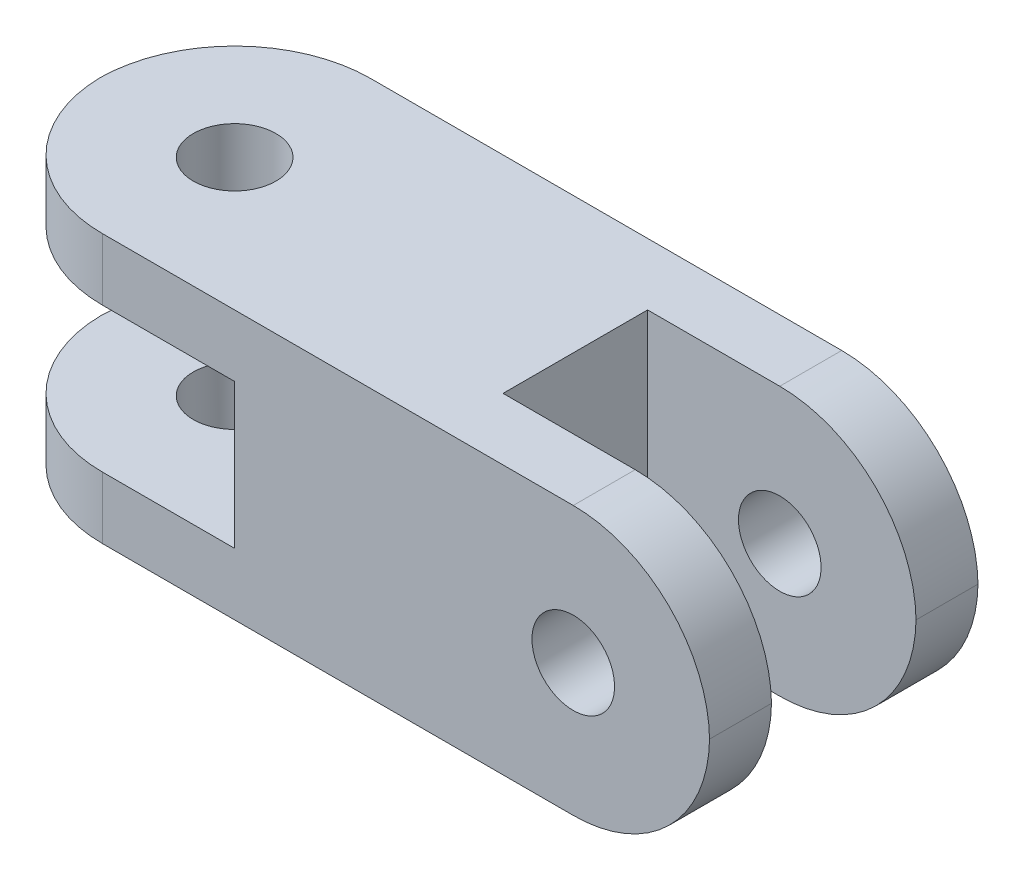
from build123d import *

# Parameters (mm, degrees)
ESBO_O1_W                  = 180
ESBO_O1_H                  = 65
RESSALTO_EXTRUS_O2_DEPTH   = 32.5
FILETE1_R                  = 33
CORTE_EXTRUS_O1_DEPTH      = 102.056914657
CORTE_EXTRUS_O1_DEPTH_BACK = 102.056914657
ESBO_O2_W                  = 65
ESBO_O2_H                  = 35
FILETE4_R                  = 33
ESBO_O4_W                  = 65
ESBO_O4_H                  = 35
CORTE_EXTRUS_O2_DEPTH      = 116.674405799
ESBO_O5_R                  = 10
CORTE_EXTRUS_O3_DEPTH      = 116.674405799
ESBO_O6_R                  = 10
CORTE_EXTRUS_O4_DEPTH      = 116.674405799


with BuildPart() as part:
    # Esboço1 → Ressalto-extrusão2 (new, symmetric)
    with BuildSketch(Plane.XY):
        Rectangle(ESBO_O1_W, ESBO_O1_H)
    extrude(amount=RESSALTO_EXTRUS_O2_DEPTH, both=True)

    # Filete1
    # the kernel refuses this fillet: 33 mm, written as the material it takes off along each edge
    with BuildSketch(Plane(origin=(-90, -115, 32.5), x_dir=(1, 0, 0), z_dir=(0, 1, 0))) as filete1_piece_1:
        with BuildLine():
            CenterArc((FILETE1_R, FILETE1_R), FILETE1_R, 180, 90)
            Line((0, FILETE1_R), (0, 0))
            Line((0, 0), (FILETE1_R, 0))
        make_face()
    extrude(amount=230, mode=Mode.SUBTRACT)
    with BuildSketch(Plane(origin=(-90, -115, -32.5), x_dir=(1, 0, 0), z_dir=(0, 1, 0))) as filete1_piece_2:
        with BuildLine():
            CenterArc((FILETE1_R, -FILETE1_R), FILETE1_R, 90, 90)
            Line((0, -FILETE1_R), (0, 0))
            Line((0, 0), (FILETE1_R, 0))
        make_face()
    extrude(amount=230, mode=Mode.SUBTRACT)

    # Esboço2 → Corte-extrusão1 (cut, two sides: drawn at the far end of the back side and taken through both)
    with BuildSketch(Plane.XY.offset(-CORTE_EXTRUS_O1_DEPTH_BACK)):
        with Locations((-57.496211904, 0)):
            Rectangle(ESBO_O2_W, ESBO_O2_H)
    extrude(amount=CORTE_EXTRUS_O1_DEPTH + CORTE_EXTRUS_O1_DEPTH_BACK, mode=Mode.SUBTRACT)

    # Filete4
    # the kernel refuses this fillet: 33 mm, written as the material it takes off along each edge
    with BuildSketch(Plane(origin=(90, -32.5, 115), x_dir=(0, 1, 0), z_dir=(0, 0, -1)), Plane(origin=(90, 32.5, 115), x_dir=(-1, 0, 0), z_dir=(0, 0, -1))) as filete4_piece_1:
        with BuildLine():
            CenterArc((FILETE4_R, -FILETE4_R), FILETE4_R, 90, 90)
            Line((0, -FILETE4_R), (0, 0))
            Line((0, 0), (FILETE4_R, 0))
        make_face()
    extrude(amount=230, mode=Mode.SUBTRACT)

    # Esboço4 → Corte-extrusão2 (cut, through all)
    with BuildSketch(Plane(origin=(0, 32.5, 0), x_dir=(1, 0, 0), z_dir=(0, 1, 0))):
        with Locations((57.496211904, 0)):
            Rectangle(ESBO_O4_W, ESBO_O4_H)
    extrude(amount=-CORTE_EXTRUS_O2_DEPTH, mode=Mode.SUBTRACT)

    # Esboço5 → Corte-extrusão3 (cut, through all)
    with BuildSketch(Plane(origin=(0, 0, -32.5), x_dir=(-1, 0, 0), z_dir=(0, 0, -1))):
        with Locations((-57, -0.5)):
            Circle(ESBO_O5_R)
    extrude(amount=-CORTE_EXTRUS_O3_DEPTH, mode=Mode.SUBTRACT)

    # Esboço6 → Corte-extrusão4 (cut, through all)
    with BuildSketch(Plane(origin=(0, 32.5, 0), x_dir=(1, 0, 0), z_dir=(0, 1, 0))):
        with Locations(Location((-57, -0.5, 0), (0, 0, 270))):
            Circle(ESBO_O6_R)
    extrude(amount=-CORTE_EXTRUS_O4_DEPTH, mode=Mode.SUBTRACT)


solid = part.part
